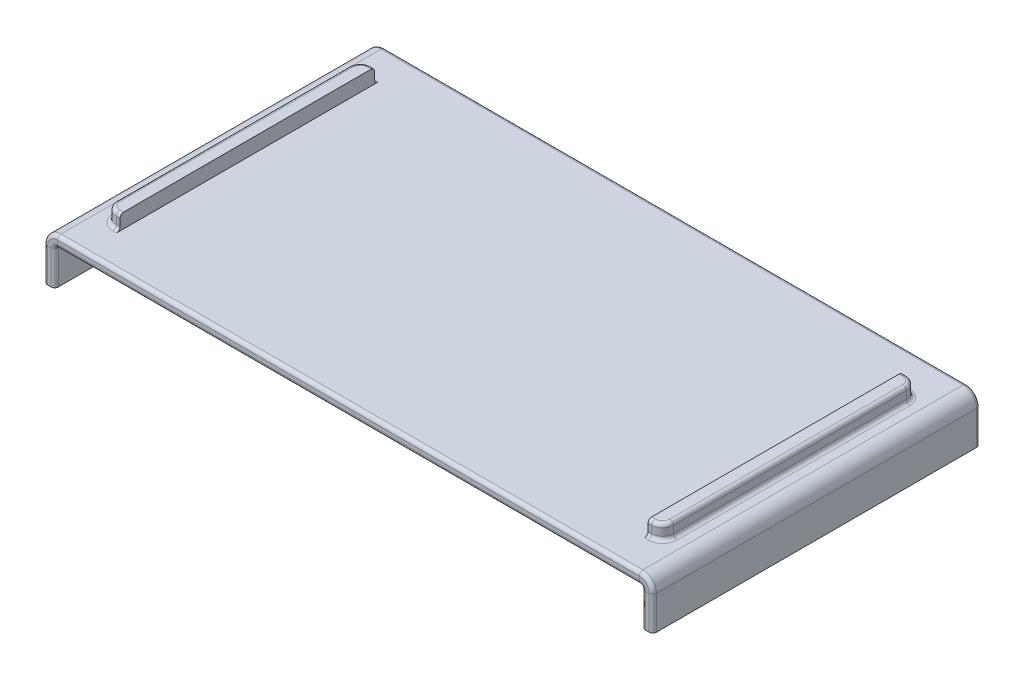
from build123d import *

# Parameters (mm, degrees)
ESQUISSE1_W                 = 160
ESQUISSE1_H                 = 90
T_LE_DE_BASE_PLI_E1_DEPTH   = 3
T_LE_PLI_E_SUR_AR_TE1_DEPTH = 90
T_LE_PLI_E_SUR_AR_TE2_DEPTH = 90
EXTRUSION1_DEPTH            = 4
CONG_2_R                    = 1
CONG_3_R                    = 1
CONG_4_R                    = 1


# Sheet-metal steps are written as plain solids
with BuildPart() as part:
    # Esquisse1 → Tôle de base pliée1 (new body)
    with BuildSketch(Plane(origin=(0, 0, 0), x_dir=(1, 0, 0), z_dir=(0, 1, 0))):
        with Locations((-26.903987823, 16.826605784)):
            Rectangle(ESQUISSE1_W, ESQUISSE1_H)
    extrude(amount=T_LE_DE_BASE_PLI_E1_DEPTH)

    # Tôle pliée sur arête1 section (across the edge) → Tôle pliée sur arête1 (add)
    with BuildSketch(Plane(origin=(53.832612177, 0, -61.826605784), x_dir=(-1, 0, 0), z_dir=(0, 0, 1))):
        with BuildLine():
            Line((-3, 0.7366), (-3, 10))
            Line((-3, 10), (0, 10))
            Line((0, 10), (0, 0.7366))
            ThreePointArc((0, 0.7366), (0.215745145, 0.215745145), (0.7366, 0))
            Line((0.7366, 0), (0.7366, -3))
            ThreePointArc((0.7366, -3), (-1.905575199, -1.905575199), (-3, 0.7366))
        make_face()
    extrude(amount=T_LE_PLI_E_SUR_AR_TE1_DEPTH)

    # Tôle pliée sur arête2 section (across the edge) → Tôle pliée sur arête2 (add)
    with BuildSketch(Plane(origin=(-107.640587823, 0, 28.173394216), x_dir=(1, 0, 0), z_dir=(0, 0, -1))):
        with BuildLine():
            Line((-3, 0.7366), (-3, 10))
            Line((-3, 10), (0, 10))
            Line((0, 10), (0, 0.7366))
            ThreePointArc((0, 0.7366), (0.215745145, 0.215745145), (0.7366, 0))
            Line((0.7366, 0), (0.7366, -3))
            ThreePointArc((0.7366, -3), (-1.905575199, -1.905575199), (-3, 0.7366))
        make_face()
    extrude(amount=T_LE_PLI_E_SUR_AR_TE2_DEPTH)

    # Esquisse9 → Extrusion1 (add)
    with BuildSketch(Plane(origin=(0, 3, 0), x_dir=(1, 0, 0), z_dir=(0, 1, 0))):
        with BuildLine():
            Line((-100.504826498, 51.644704016), (-99.504826498, 51.644704016))
            Line((-99.504826498, 51.644704016), (-99.504826498, -18.355295984))
            Line((-99.504826498, -18.355295984), (-100.504826498, -18.355295984))
            ThreePointArc((-100.504826498, -18.355295984), (-102.626146841, -17.476616327), (-103.504826498, -15.355295984))
            Line((-103.504826498, -15.355295984), (-103.504826498, 48.644704016))
            ThreePointArc((-103.504826498, 48.644704016), (-102.626146841, 50.76602436), (-100.504826498, 51.644704016))
        make_face()
        with BuildLine():
            Line((45.696850851, 51.644704016), (45.696850851, -18.355295984))
            Line((45.696850851, -18.355295984), (46.696850851, -18.355295984))
            ThreePointArc((46.696850851, -18.355295984), (48.818171195, -17.476616327), (49.696850851, -15.355295984))
            Line((49.696850851, -15.355295984), (49.696850851, 48.644704016))
            ThreePointArc((49.696850851, 48.644704016), (48.818171195, 50.76602436), (46.696850851, 51.644704016))
            Line((46.696850851, 51.644704016), (45.696850851, 51.644704016))
        make_face()
    extrude(amount=EXTRUSION1_DEPTH)

    # Congé2
    cong_2_edges = [part.edges().sort_by_distance(p)[0] for p in [
        (-26.903987823, 3, -61.826605784),
        (55.738187375, 1.905575199, -61.826605784),
        (55.738187375, 1.905575199, 28.173394216),
        (53.616867032, -0.215745145, -61.826605784),
        (53.616867032, -0.215745145, 28.173394216),
        (53.832612177, -5.3683, 28.173394216),
        (53.832612177, -5.3683, -61.826605784),
        (56.832612177, -5.3683, 28.173394216),
        (56.832612177, -5.3683, -61.826605784),
        (-109.546163022, 1.905575199, 28.173394216),
        (-109.546163022, 1.905575199, -61.826605784),
        (-107.424842678, -0.215745145, 28.173394216),
        (-107.424842678, -0.215745145, -61.826605784),
        (-26.903987823, 0, -61.826605784),
        (-107.640587823, -5.3683, -61.826605784),
        (-107.640587823, -5.3683, 28.173394216),
        (-110.640587823, -5.3683, -61.826605784),
        (-110.640587823, -5.3683, 28.173394216),
        (-26.903987823, 0, 28.173394216),
        (-26.903987823, 3, 28.173394216),
    ]]
    fillet(cong_2_edges, radius=CONG_2_R)

    # Congé3
    cong_3_edges = [part.edges().sort_by_distance(p)[0] for p in [
        (-100.004826498, 7, -51.644704016),
        (-102.626146841, 7, -50.76602436),
        (-103.504826498, 7, -16.644704016),
        (-102.626146841, 7, 17.476616327),
        (-100.004826498, 7, 18.355295984),
        (48.818171195, 7, 17.476616327),
        (49.696850851, 7, -16.644704016),
        (48.818171195, 7, -50.76602436),
        (46.196850851, 7, -51.644704016),
        (46.196850851, 7, 18.355295984),
    ]]
    fillet(cong_3_edges, radius=CONG_3_R)

    # Congé4
    cong_4_edges = [part.edges().sort_by_distance(p)[0] for p in [
        (-100.004826498, 3, -51.644704016),
        (-102.626146841, 3, -50.76602436),
        (-103.504826498, 3, -16.644704016),
        (-102.626146841, 3, 17.476616327),
        (-100.004826498, 3, 18.355295984),
        (48.818171195, 3, 17.476616327),
        (49.696850851, 3, -16.644704016),
        (48.818171195, 3, -50.76602436),
        (46.196850851, 3, -51.644704016),
        (46.196850851, 3, 18.355295984),
    ]]
    fillet(cong_4_edges, radius=CONG_4_R)


solid = part.part
